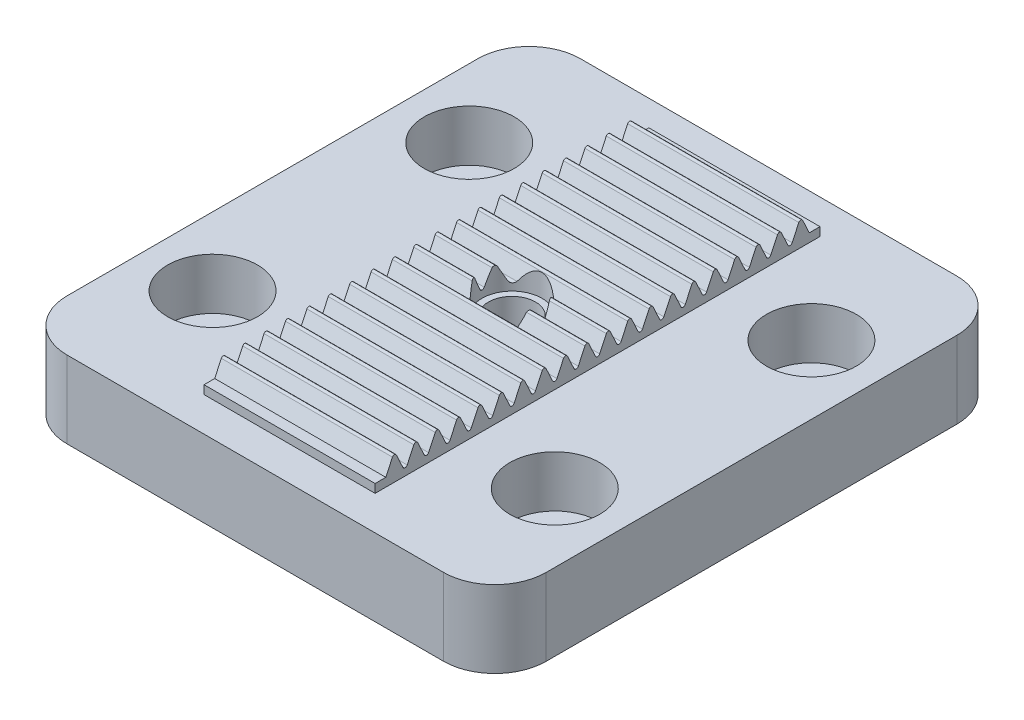
from build123d import *

# Parameters (mm, degrees)
SKETCH1_W           = 56
SKETCH1_H           = 60
SKETCH1_R           = 3.25
BOSS_EXTRUDE1_DEPTH = 3
SKETCH2_W           = 56
SKETCH2_H           = 60
SKETCH2_R           = 5.25
BOSS_EXTRUDE2_DEPTH = 6
FILLET1_R           = 6
BOSS_EXTRUDE3_DEPTH = 10
SKETCH4_R           = 2.75
CUT_EXTRUDE2_DEPTH  = 43.700231647
SKETCH5_R           = 3.5
CUT_EXTRUDE3_DEPTH  = 43.011903097
CUT_EXTRUDE4_DEPTH  = 5


with BuildPart() as part:
    # Sketch1 → Boss-Extrude1 (new body)
    with BuildSketch(Plane(origin=(0, 0, 0), x_dir=(1, 0, 0), z_dir=(0, 1, 0))):
        Rectangle(SKETCH1_W, SKETCH1_H)
        with Locations((-20, 15)):
            Circle(SKETCH1_R, mode=Mode.SUBTRACT)
        with Locations((-20, -15)):
            Circle(SKETCH1_R, mode=Mode.SUBTRACT)
        with Locations((20, -15)):
            Circle(SKETCH1_R, mode=Mode.SUBTRACT)
        with Locations((20, 15)):
            Circle(SKETCH1_R, mode=Mode.SUBTRACT)
    extrude(amount=BOSS_EXTRUDE1_DEPTH)

    # Sketch2 → Boss-Extrude2 (add)
    with BuildSketch(Plane(origin=(0, 3, 0), x_dir=(1, 0, 0), z_dir=(0, 1, 0))):
        Rectangle(SKETCH2_W, SKETCH2_H)
        with Locations((-20, 15)):
            Circle(SKETCH2_R, mode=Mode.SUBTRACT)
        with Locations((-20, -15)):
            Circle(SKETCH2_R, mode=Mode.SUBTRACT)
        with Locations((20, -15)):
            Circle(SKETCH2_R, mode=Mode.SUBTRACT)
        with Locations((20, 15)):
            Circle(SKETCH2_R, mode=Mode.SUBTRACT)
    extrude(amount=BOSS_EXTRUDE2_DEPTH)

    # Fillet1
    fillet1_edges = [part.edges().sort_by_distance(p)[0] for p in [
        (28, 4.5, -30),
        (-28, 4.5, -30),
        (-28, 4.5, 30),
        (28, 4.5, 30),
    ]]
    fillet(fillet1_edges, radius=FILLET1_R)

    # Sketch3 → Boss-Extrude3 (add, symmetric)
    with BuildSketch(Plane(origin=(0, 0, 0), x_dir=(0, 0, -1), z_dir=(1, 0, 0))):
        with BuildLine():
            Line((-26, 9), (-26, 10))
            Line((-26, 10), (-24.75, 10))
            Line((-24.75, 10), (-23.976576947, 11.65861109))
            ThreePointArc((-23.976576947, 11.65861109), (-23.75, 11.802956525), (-23.523423053, 11.65861109))
            Line((-23.523423053, 11.65861109), (-22.75, 10))
            ThreePointArc((-22.75, 10), (-22.5, 9.840732435), (-22.25, 10))
            Line((-22.25, 10), (-21.476576947, 11.65861109))
            ThreePointArc((-21.476576947, 11.65861109), (-21.25, 11.802956525), (-21.023423053, 11.65861109))
            Line((-21.023423053, 11.65861109), (-20.25, 10))
            ThreePointArc((-20.25, 10), (-20, 9.840732435), (-19.75, 10))
            Line((-19.75, 10), (-18.976576947, 11.65861109))
            ThreePointArc((-18.976576947, 11.65861109), (-18.75, 11.802956525), (-18.523423053, 11.65861109))
            Line((-18.523423053, 11.65861109), (-17.75, 10))
            ThreePointArc((-17.75, 10), (-17.5, 9.840732435), (-17.25, 10))
            Line((-17.25, 10), (-16.476576947, 11.65861109))
            ThreePointArc((-16.476576947, 11.65861109), (-16.25, 11.802956525), (-16.023423053, 11.65861109))
            Line((-16.023423053, 11.65861109), (-15.25, 10))
            ThreePointArc((-15.25, 10), (-15, 9.840732435), (-14.75, 10))
            Line((-14.75, 10), (-13.976576947, 11.65861109))
            ThreePointArc((-13.976576947, 11.65861109), (-13.75, 11.802956525), (-13.523423053, 11.65861109))
            Line((-13.523423053, 11.65861109), (-12.75, 10))
            ThreePointArc((-12.75, 10), (-12.5, 9.840732435), (-12.25, 10))
            Line((-12.25, 10), (-11.476576947, 11.65861109))
            ThreePointArc((-11.476576947, 11.65861109), (-11.25, 11.802956525), (-11.023423053, 11.65861109))
            Line((-11.023423053, 11.65861109), (-10.25, 10))
            ThreePointArc((-10.25, 10), (-10, 9.840732435), (-9.75, 10))
            Line((-9.75, 10), (-8.976576947, 11.65861109))
            ThreePointArc((-8.976576947, 11.65861109), (-8.75, 11.802956525), (-8.523423053, 11.65861109))
            Line((-8.523423053, 11.65861109), (-7.75, 10))
            ThreePointArc((-7.75, 10), (-7.5, 9.840732435), (-7.25, 10))
            Line((-7.25, 10), (-6.476576947, 11.65861109))
            ThreePointArc((-6.476576947, 11.65861109), (-6.25, 11.802956525), (-6.023423053, 11.65861109))
            Line((-6.023423053, 11.65861109), (-5.25, 10))
            ThreePointArc((-5.25, 10), (-5, 9.840732435), (-4.75, 10))
            Line((-4.75, 10), (-3.976576947, 11.65861109))
            ThreePointArc((-3.976576947, 11.65861109), (-3.75, 11.802956525), (-3.523423053, 11.65861109))
            Line((-3.523423053, 11.65861109), (-2.75, 10))
            ThreePointArc((-2.75, 10), (-2.5, 9.840732435), (-2.25, 10))
            Line((-2.25, 10), (-1.476576947, 11.65861109))
            ThreePointArc((-1.476576947, 11.65861109), (-1.25, 11.802956525), (-1.023423053, 11.65861109))
            Line((-1.023423053, 11.65861109), (-0.25, 10))
            ThreePointArc((-0.25, 10), (0, 9.840732435), (0.25, 10))
            Line((0.25, 10), (1.023423053, 11.65861109))
            ThreePointArc((1.023423053, 11.65861109), (1.25, 11.802956525), (1.476576947, 11.65861109))
            Line((1.476576947, 11.65861109), (2.25, 10))
            ThreePointArc((2.25, 10), (2.5, 9.840732435), (2.75, 10))
            Line((2.75, 10), (3.523423053, 11.65861109))
            ThreePointArc((3.523423053, 11.65861109), (3.75, 11.802956525), (3.976576947, 11.65861109))
            Line((3.976576947, 11.65861109), (4.75, 10))
            ThreePointArc((4.75, 10), (5, 9.840732435), (5.25, 10))
            Line((5.25, 10), (6.023423053, 11.65861109))
            ThreePointArc((6.023423053, 11.65861109), (6.25, 11.802956525), (6.476576947, 11.65861109))
            Line((6.476576947, 11.65861109), (7.25, 10))
            ThreePointArc((7.25, 10), (7.5, 9.840732435), (7.75, 10))
            Line((7.75, 10), (8.523423053, 11.65861109))
            ThreePointArc((8.523423053, 11.65861109), (8.75, 11.802956525), (8.976576947, 11.65861109))
            Line((8.976576947, 11.65861109), (9.75, 10))
            ThreePointArc((9.75, 10), (10, 9.840732435), (10.25, 10))
            Line((10.25, 10), (11.023423053, 11.65861109))
            ThreePointArc((11.023423053, 11.65861109), (11.25, 11.802956525), (11.476576947, 11.65861109))
            Line((11.476576947, 11.65861109), (12.25, 10))
            ThreePointArc((12.25, 10), (12.5, 9.840732435), (12.75, 10))
            Line((12.75, 10), (13.523423053, 11.65861109))
            ThreePointArc((13.523423053, 11.65861109), (13.75, 11.802956525), (13.976576947, 11.65861109))
            Line((13.976576947, 11.65861109), (14.75, 10))
            ThreePointArc((14.75, 10), (15, 9.840732435), (15.25, 10))
            Line((15.25, 10), (16.023423053, 11.65861109))
            ThreePointArc((16.023423053, 11.65861109), (16.25, 11.802956525), (16.476576947, 11.65861109))
            Line((16.476576947, 11.65861109), (17.25, 10))
            ThreePointArc((17.25, 10), (17.5, 9.840732435), (17.75, 10))
            Line((17.75, 10), (18.523423053, 11.65861109))
            ThreePointArc((18.523423053, 11.65861109), (18.75, 11.802956525), (18.976576947, 11.65861109))
            Line((18.976576947, 11.65861109), (19.75, 10))
            ThreePointArc((19.75, 10), (20, 9.840732435), (20.25, 10))
            Line((20.25, 10), (21.023423053, 11.65861109))
            ThreePointArc((21.023423053, 11.65861109), (21.25, 11.802956525), (21.476576947, 11.65861109))
            Line((21.476576947, 11.65861109), (22.25, 10))
            ThreePointArc((22.25, 10), (22.5, 9.840732435), (22.75, 10))
            Line((22.75, 10), (23.523423053, 11.65861109))
            ThreePointArc((23.523423053, 11.65861109), (23.75, 11.802956525), (23.976576947, 11.65861109))
            Line((23.976576947, 11.65861109), (24.75, 10))
            Line((24.75, 10), (26, 10))
            Line((26, 10), (26, 9))
            Line((26, 9), (-26, 9))
        make_face()
    extrude(amount=BOSS_EXTRUDE3_DEPTH, both=True)

    # Sketch4 → Cut-Extrude2 (cut, through all)
    with BuildSketch(Plane(origin=(0, 0, 0), x_dir=(1, 0, 0), z_dir=(0, 1, 0))):
        Circle(SKETCH4_R)
    extrude(amount=CUT_EXTRUDE2_DEPTH, mode=Mode.SUBTRACT)

    # Sketch5 → Cut-Extrude3 (cut, through all)
    with BuildSketch(Plane(origin=(0, 9, 0), x_dir=(1, 0, 0), z_dir=(0, 1, 0))):
        Circle(SKETCH5_R)
    extrude(amount=CUT_EXTRUDE3_DEPTH, mode=Mode.SUBTRACT)

    # Sketch6 → Cut-Extrude4 (cut)
    with BuildSketch(Plane.XZ):
        Polygon((4.25, -2.453738644), (4.25, 2.453738644), (0, 4.907477288), (-4.25, 2.453738644), (-4.25, -2.453738644), (0, -4.907477288), align=None)
    extrude(amount=-CUT_EXTRUDE4_DEPTH, mode=Mode.SUBTRACT)


solid = part.part
